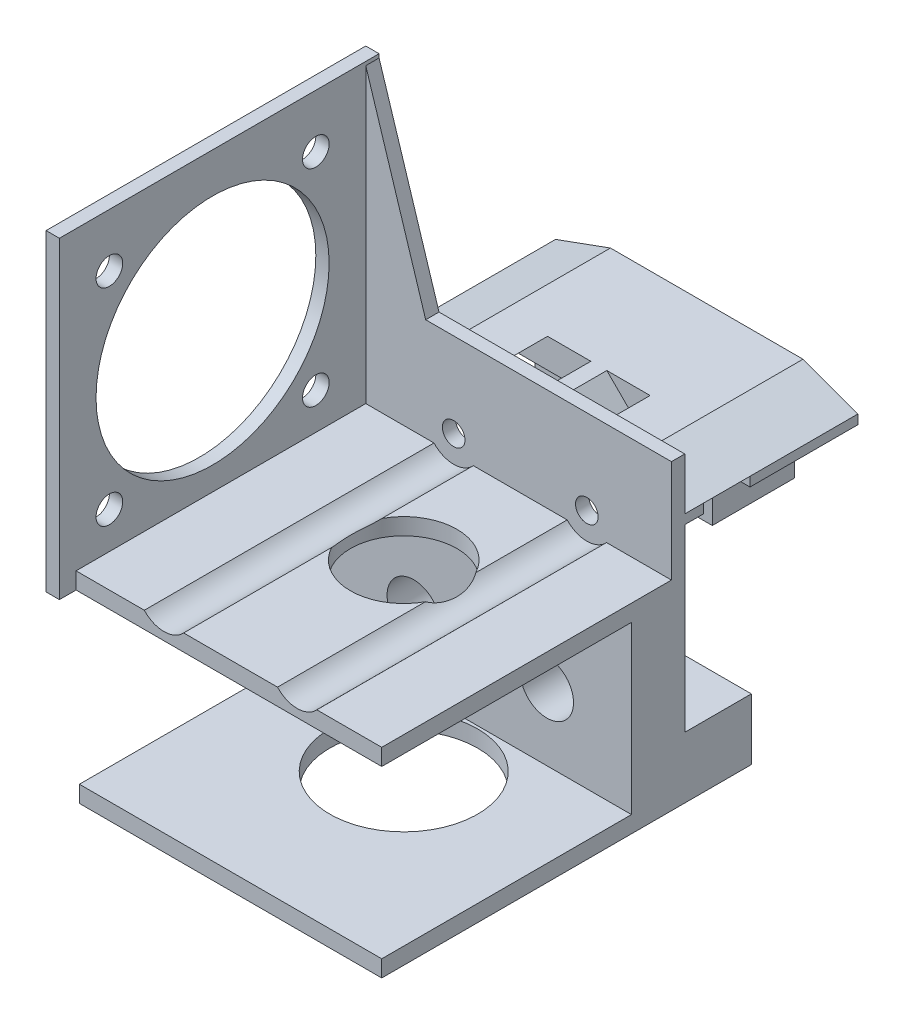
from build123d import *

# Parameters (mm, degrees)
SKETCH1_W                = 45.4
SKETCH1_H                = 45.4
BOSS_EXTRUDE1_DEPTH      = 12
SKETCH2_W                = 45.4
SKETCH2_H                = 27
CUT_EXTRUDE1_DEPTH       = 10
CUT_EXTRUDE4_REACH       = 67.317
SKETCH13_R               = 1.7
SKETCH20_W               = 7
SKETCH20_H               = 1.4
CUT_EXTRUDE10_DEPTH      = 15
SKETCH21_W               = 10
SKETCH21_H               = 4.8
CUT_EXTRUDE11_DEPTH      = 66.317072806
SKETCH22_W               = 7
SKETCH22_H               = 1.4
CUT_EXTRUDE12_DEPTH      = 15
SKETCH29_W               = 45.4
SKETCH29_H               = 30
BOSS_EXTRUDE6_DEPTH      = 43.5
SKETCH26_W               = 45.4
SKETCH26_H               = 4.4
BOSS_EXTRUDE4_DEPTH      = 16
CUT_EXTRUDE13_DEPTH      = 15
CUT_EXTRUDE13_DEPTH_BACK = 15
SKETCH23_W               = 2
SKETCH23_H               = 7
SKETCH17_R               = 4
CUT_EXTRUDE8_DEPTH       = 78.553658843
CHAMFER1_SIZE2           = 8.242432258
CHAMFER1_SIZE            = 3
CHAMFER2_SIZE2           = 3
CHAMFER2_SIZE            = 8.242432258
SKETCH24_W               = 2
SKETCH24_H               = 9.2
BOSS_EXTRUDE2_DEPTH      = 10.25
SKETCH25_W               = 1.5
SKETCH25_H               = 9.2
BOSS_EXTRUDE3_DEPTH      = 10
FILLET1_R                = 4
CHAMFER3_SIZE            = 3
CHAMFER4_SIZE            = 4.5
SKETCH27_W               = 26.630251868
SKETCH27_H               = 12.344948638
BOSS_EXTRUDE5_DEPTH      = 11.7
SKETCH36_W               = 37.5
SKETCH36_H               = 25
CUT_EXTRUDE18_DEPTH      = 85.867956261
SKETCH28_R               = 1.5
CUT_EXTRUDE14_DEPTH      = 10
SKETCH31_R               = 8
CUT_EXTRUDE15_DEPTH      = 35
SKETCH32_R               = 11.1
CUT_EXTRUDE16_DEPTH      = 27.5
BOSS_EXTRUDE7_DEPTH      = 0.5
SKETCH34_W               = 48
SKETCH34_H               = 47
BOSS_EXTRUDE8_DEPTH      = 2
SKETCH35_R               = 2
SKETCH35_R_2             = 17.5
CUT_EXTRUDE17_DEPTH      = 10
CHAMFER7_SIZE            = 9
CHAMFER7_SIZE2           = 28.544353221


# Some blends are built 0.0001 mm under size
with BuildPart() as part:
    # Sketch1 → Boss-Extrude1 (new body)
    with BuildSketch(Plane.XY):
        with Locations((22.7, 22.7)):
            Rectangle(SKETCH1_W, SKETCH1_H)
    extrude(amount=BOSS_EXTRUDE1_DEPTH)

    # Sketch2 → Cut-Extrude1 (cut)
    with BuildSketch(Plane(origin=(0, 0, 0), x_dir=(-1, 0, 0), z_dir=(0, 0, -1))):
        with Locations((-22.7, 22.7)):
            Rectangle(SKETCH2_W, SKETCH2_H)
    extrude(amount=-CUT_EXTRUDE1_DEPTH, mode=Mode.SUBTRACT)

    # Sketch13 → Cut-Extrude4 (cut, up to next)
    with BuildSketch(Plane.XY.offset(12), mode=Mode.PRIVATE) as cut_extrude4_sk1:
        with Locations((32.7, 32.7)):
            Circle(SKETCH13_R)
    cut_extrude4_tool1 = extrude(cut_extrude4_sk1.sketch, amount=-CUT_EXTRUDE4_REACH, mode=Mode.PRIVATE) & part.part
    # Sketch13 → Cut-Extrude4 (cut, up to next)
    with BuildSketch(Plane.XY.offset(12), mode=Mode.PRIVATE) as cut_extrude4_sk2:
        with Locations((12.7, 32.7)):
            Circle(SKETCH13_R)
    cut_extrude4_tool2 = extrude(cut_extrude4_sk2.sketch, amount=-CUT_EXTRUDE4_REACH, mode=Mode.PRIVATE) & part.part
    # Sketch13 → Cut-Extrude4 (cut, up to next)
    with BuildSketch(Plane.XY.offset(12), mode=Mode.PRIVATE) as cut_extrude4_sk3:
        with Locations((32.7, 12.7)):
            Circle(SKETCH13_R)
    cut_extrude4_tool3 = extrude(cut_extrude4_sk3.sketch, amount=-CUT_EXTRUDE4_REACH, mode=Mode.PRIVATE) & part.part
    # Sketch13 → Cut-Extrude4 (cut, up to next)
    with BuildSketch(Plane.XY.offset(12), mode=Mode.PRIVATE) as cut_extrude4_sk4:
        with Locations((12.7, 12.7)):
            Circle(SKETCH13_R)
    cut_extrude4_tool4 = extrude(cut_extrude4_sk4.sketch, amount=-CUT_EXTRUDE4_REACH, mode=Mode.PRIVATE) & part.part
    add(cut_extrude4_tool1.solids().sort_by_distance((32.7, 32.7, 12))[0], mode=Mode.SUBTRACT)
    add(cut_extrude4_tool2.solids().sort_by_distance((12.7, 32.7, 12))[0], mode=Mode.SUBTRACT)
    add(cut_extrude4_tool3.solids().sort_by_distance((32.7, 12.7, 12))[0], mode=Mode.SUBTRACT)
    add(cut_extrude4_tool4.solids().sort_by_distance((12.7, 12.7, 12))[0], mode=Mode.SUBTRACT)

    # Sketch20 → Cut-Extrude10 (cut)
    with BuildSketch(Plane(origin=(45.4, 0, 0), x_dir=(0, 0, -1), z_dir=(1, 0, 0))):
        with Locations((-3.7, 36.9)):
            Rectangle(SKETCH20_W, SKETCH20_H)
    extrude(amount=-CUT_EXTRUDE10_DEPTH, mode=Mode.SUBTRACT)

    # Sketch21 → Cut-Extrude11 (cut, through all)
    with BuildSketch(Plane(origin=(45.4, 0, 0), x_dir=(0, 0, -1), z_dir=(1, 0, 0))):
        with Locations((-5, 43)):
            Rectangle(SKETCH21_W, SKETCH21_H)
    extrude(amount=-CUT_EXTRUDE11_DEPTH, mode=Mode.SUBTRACT)

    # Sketch22 → Cut-Extrude12 (cut)
    with BuildSketch(Plane.ZY):
        with Locations((3.7, 36.9)):
            Rectangle(SKETCH22_W, SKETCH22_H)
    extrude(amount=-CUT_EXTRUDE12_DEPTH, mode=Mode.SUBTRACT)

    # Sketch29 → Boss-Extrude6 (add)
    with BuildSketch(Plane.XY.offset(12)):
        with Locations((22.7, 15)):
            Rectangle(SKETCH29_W, SKETCH29_H)
    extrude(amount=BOSS_EXTRUDE6_DEPTH)

    # Sketch26 → Boss-Extrude4 (add)
    with BuildSketch(Plane(origin=(0, 0, 0), x_dir=(-1, 0, 0), z_dir=(0, 0, -1))):
        with Locations((-22.7, 38.4)):
            Rectangle(SKETCH26_W, SKETCH26_H)
    extrude(amount=BOSS_EXTRUDE4_DEPTH)

    # Sketch23 → Cut-Extrude13 (cut, two sides: drawn at the far end of the back side and taken through both)
    with BuildSketch(Plane(origin=(0, 40.6, 0), x_dir=(1, 0, 0), z_dir=(0, 1, 0)).offset(-CUT_EXTRUDE13_DEPTH_BACK)):
        with Locations((29.4, -3.7)):
            Rectangle(SKETCH23_W, SKETCH23_H)
        with Locations((16, -3.7)):
            Rectangle(SKETCH23_W, SKETCH23_H)
    extrude(amount=CUT_EXTRUDE13_DEPTH + CUT_EXTRUDE13_DEPTH_BACK, mode=Mode.SUBTRACT)

    # Sketch17 → Cut-Extrude8 (cut, through all)
    with BuildSketch(Plane.XY.offset(12)):
        with Locations((12.7, 32.7)):
            Circle(SKETCH17_R)
        with Locations((32.7, 32.7)):
            Circle(SKETCH17_R)
        with Locations((32.7, 12.7)):
            Circle(SKETCH17_R)
        with Locations((12.7, 12.7)):
            Circle(SKETCH17_R)
    extrude(amount=CUT_EXTRUDE8_DEPTH, mode=Mode.SUBTRACT)

    # Chamfer1
    chamfer1_edges = [part.edges().sort_by_distance(p)[0] for p in [
        (45.4, 40.6, -3),
    ]]
    chamfer1_side = [part.faces().sort_by_distance(p)[0] for p in [
        (45.4, 40.54, -3),
    ]]
    chamfer(chamfer1_edges, length=CHAMFER1_SIZE - 0.0001, length2=CHAMFER1_SIZE2 - 0.0001, reference=chamfer1_side[0])  # a hair under: the kernel refuses the full size

    # Chamfer2
    chamfer2_edges = [part.edges().sort_by_distance(p)[0] for p in [
        (0, 40.6, -3),
    ]]
    chamfer2_side = [part.faces().sort_by_distance(p)[0] for p in [
        (0.06, 40.6, -3),
    ]]
    chamfer(chamfer2_edges, length=CHAMFER2_SIZE - 0.0001, length2=CHAMFER2_SIZE2 - 0.0001, reference=chamfer2_side[0])  # a hair under: the kernel refuses the full size

    # Sketch24 → Boss-Extrude2 (add)
    with BuildSketch(Plane(origin=(0, 0, 0), x_dir=(-1, 0, 0), z_dir=(0, 0, -1))):
        with Locations((-11, 4.6)):
            Rectangle(SKETCH24_W, SKETCH24_H)
    extrude(amount=BOSS_EXTRUDE2_DEPTH)

    # Sketch25 → Boss-Extrude3 (add)
    with BuildSketch(Plane.ZY.offset(-10)):
        with Locations((-9.5, 4.6)):
            Rectangle(SKETCH25_W, SKETCH25_H)
    extrude(amount=BOSS_EXTRUDE3_DEPTH)

    # Fillet1
    fillet1_edges = [part.edges().sort_by_distance(p)[0] for p in [
        (12, 4.6, -10.25),
        (10, 4.6, -8.75),
    ]]
    fillet(fillet1_edges, radius=FILLET1_R)

    # Chamfer3
    chamfer3_edges = [part.edges().sort_by_distance(p)[0] for p in [
        (15, 37.6, 3.7),
        (30.4, 37.6, 3.7),
    ]]
    chamfer(chamfer3_edges, length=CHAMFER3_SIZE - 0.0001)  # a hair under: the kernel refuses the full size

    # Chamfer4
    # the kernel refuses this chamfer: 4.5 mm, written as the material it takes off along each edge
    with BuildSketch(Plane(origin=(28.4, 40.6, 0.2), x_dir=(-0.9996219169112966, 0.027495876610586785, 0), z_dir=(0, 0, 1))) as chamfer4_piece_1:
        Polygon((CHAMFER4_SIZE * 0.999621916911, CHAMFER4_SIZE * 0.0274958766106), (-CHAMFER4_SIZE * 0.0274958766106, CHAMFER4_SIZE * 0.999621916911), (0, 0), align=None)
    extrude(amount=7, mode=Mode.SUBTRACT)
    with BuildSketch(Plane(origin=(17, 40.6, 0.2), x_dir=(0.9996219169112966, 0.027495876610586785, 0), z_dir=(0, 0, 1))) as chamfer4_piece_2:
        Polygon((CHAMFER4_SIZE * 0.999621916911, -CHAMFER4_SIZE * 0.0274958766106), (-CHAMFER4_SIZE * 0.0274958766106, -CHAMFER4_SIZE * 0.999621916911), (0, 0), align=None)
    extrude(amount=7, mode=Mode.SUBTRACT)

    # Sketch27 → Boss-Extrude5 (add)
    with BuildSketch(Plane.XZ.offset(-36.2)):
        with Locations((22.562894264, -9.827525681)):
            Rectangle(SKETCH27_W, SKETCH27_H)
    extrude(amount=BOSS_EXTRUDE5_DEPTH)

    # Sketch36 → Cut-Extrude18 (cut, through all)
    with BuildSketch(Plane(origin=(45.4, 0, 0), x_dir=(0, 0, -1), z_dir=(1, 0, 0))):
        with Locations((-36.75, 15)):
            Rectangle(SKETCH36_W, SKETCH36_H)
    extrude(amount=-CUT_EXTRUDE18_DEPTH, mode=Mode.SUBTRACT)

    # Sketch28 → Cut-Extrude14 (cut)
    with BuildSketch(Plane.XZ.offset(-24.5)):
        with Locations(Location((31.697973452, -9.765616126, 0), (0, 0, 270))):
            Circle(SKETCH28_R)
        with Locations(Location((13.699854881, -9.763930868, 0), (0, 0, 270))):
            Circle(SKETCH28_R)
    extrude(amount=-CUT_EXTRUDE14_DEPTH, mode=Mode.SUBTRACT)

    # Sketch31 → Cut-Extrude15 (cut)
    with BuildSketch(Plane(origin=(0, 30, 0), x_dir=(1, 0, 0), z_dir=(0, 1, 0))):
        with Locations(Location((22.7, -29.5, 0), (0, 0, 270))):
            Circle(SKETCH31_R)
    extrude(amount=-CUT_EXTRUDE15_DEPTH, mode=Mode.SUBTRACT)

    # Sketch32 → Cut-Extrude16 (cut)
    with BuildSketch(Plane.XZ):
        with Locations(Location((22.7, 29.5, 0), (0, 0, 270))):
            Circle(SKETCH32_R)
    extrude(amount=-CUT_EXTRUDE16_DEPTH, mode=Mode.SUBTRACT)

    # Sketch33 → Boss-Extrude7 (add)
    with BuildSketch(Plane.ZY):
        Polygon((10, 45.4), (12, 45.4), (12, 30), (55.5, 30), (55.5, 27.5), (10, 27.5), align=None)
    extrude(amount=BOSS_EXTRUDE7_DEPTH)

    # Sketch34 → Boss-Extrude8 (add)
    with BuildSketch(Plane.ZY.offset(0.5)):
        with Locations((34, 51)):
            Rectangle(SKETCH34_W, SKETCH34_H)
    extrude(amount=BOSS_EXTRUDE8_DEPTH)

    # Sketch35 → Cut-Extrude17 (cut)
    with BuildSketch(Plane.ZY.offset(2.5)):
        with Locations((19.5, 66.5)):
            Circle(SKETCH35_R)
        with Locations((50.5, 66.5)):
            Circle(SKETCH35_R)
        with Locations((50.5, 35.5)):
            Circle(SKETCH35_R)
        with Locations((19.5, 35.5)):
            Circle(SKETCH35_R)
        with Locations((35, 51)):
            Circle(SKETCH35_R_2)
    extrude(amount=-CUT_EXTRUDE17_DEPTH, mode=Mode.SUBTRACT)

    # Chamfer7
    chamfer7_edges = [part.edges().sort_by_distance(p)[0] for p in [
        (-0.5, 45.4, 11),
    ]]
    chamfer7_side = [part.faces().sort_by_distance(p)[0] for p in [
        (22.45, 45.4, 11),
    ]]
    chamfer(chamfer7_edges, length=CHAMFER7_SIZE, length2=CHAMFER7_SIZE2, reference=chamfer7_side[0])


solid = part.part
